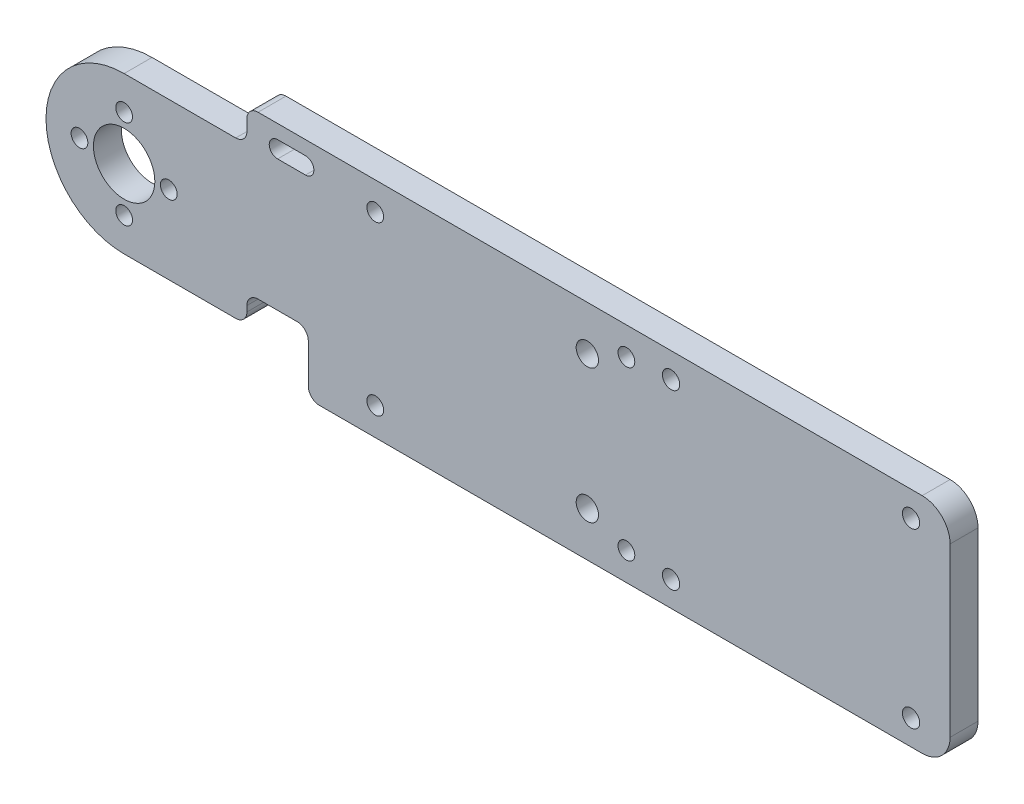
from build123d import *

# Parameters (mm, degrees)
SKETCH2_R           = 5.5
BOSS_EXTRUDE1_DEPTH = 2.5
FILLET1_R           = 5
SKETCH3_R           = 1.55
SKETCH3_R_2         = 2
SKETCH3_R_3         = 1.5
CUT_EXTRUDE1_DEPTH  = 150.428912865
SKETCH3_4_R         = 1.55
SKETCH3_4_R_2       = 2
SKETCH3_4_R_3       = 1.5
CUT_EXTRUDE2_DEPTH  = 10
FILLET2_R           = 2


with BuildPart() as part:
    # Sketch2 → Boss-Extrude1 (new, symmetric)
    with BuildSketch(Plane.XY):
        with BuildLine():
            Line((22, 14), (0, 14))
            ThreePointArc((0, 14), (-14, 0), (0, -14))
            Line((0, -14), (22, -14))
            Line((22, -14), (22, -9))
            Line((22, -9), (33, -9))
            Line((33, -9), (33, -20))
            Line((33, -20), (148, -20))
            Line((148, -20), (148, 20))
            Line((148, 20), (22, 20))
            Line((22, 20), (22, 14))
        make_face()
        Circle(SKETCH2_R, mode=Mode.SUBTRACT)
    extrude(amount=BOSS_EXTRUDE1_DEPTH, both=True)

    # Fillet1
    fillet1_edges = [part.edges().sort_by_distance(p)[0] for p in [
        (148, -20, 0),
        (148, 20, 0),
    ]]
    fillet(fillet1_edges, radius=FILLET1_R)

    # Sketch3 → Cut-Extrude1 (cut, through all)
    with BuildSketch(Plane(origin=(0, 0, -2.5), x_dir=(-1, 0, 0), z_dir=(0, 0, -1))):
        with Locations((-98, 15.5)):
            Circle(SKETCH3_R)
        with Locations((-83, 12)):
            Circle(SKETCH3_R_2)
        with Locations((-8, 0)):
            Circle(SKETCH3_R_3)
        with Locations((8, 0)):
            Circle(SKETCH3_R_3)
        with Locations((0, 8)):
            Circle(SKETCH3_R_3)
        with Locations((0, -8)):
            Circle(SKETCH3_R_3)
        with BuildLine():
            Line((-27.5, 17.5), (-32.5, 17.5))
            ThreePointArc((-32.5, 17.5), (-34, 16), (-32.5, 14.5))
            Line((-32.5, 14.5), (-27.5, 14.5))
            ThreePointArc((-27.5, 14.5), (-26, 16), (-27.5, 17.5))
        make_face()
        with Locations((-98, -15.5)):
            Circle(SKETCH3_R)
        with Locations((-141, -15.5)):
            Circle(SKETCH3_R)
        with Locations((-141, 15.5)):
            Circle(SKETCH3_R)
        with Locations((-90, -15)):
            Circle(SKETCH3_R_3)
        with Locations((-83, -12)):
            Circle(SKETCH3_R_2)
    extrude(amount=-CUT_EXTRUDE1_DEPTH, mode=Mode.SUBTRACT)

    # Sketch3<4> → Cut-Extrude2 (cut)
    with BuildSketch(Plane(origin=(0, 0, -2.5), x_dir=(-1, 0, 0), z_dir=(0, 0, -1))):
        with Locations((-98, 15.5)):
            Circle(SKETCH3_4_R)
        with Locations((-83, 12)):
            Circle(SKETCH3_4_R_2)
        with BuildLine():
            Line((-27.5, 17.5), (-32.5, 17.5))
            ThreePointArc((-32.5, 17.5), (-34, 16), (-32.5, 14.5))
            Line((-32.5, 14.5), (-27.5, 14.5))
            ThreePointArc((-27.5, 14.5), (-26, 16), (-27.5, 17.5))
        make_face()
        with Locations((-98, -15.5)):
            Circle(SKETCH3_4_R)
        with Locations((-141, -15.5)):
            Circle(SKETCH3_4_R)
        with Locations((-141, 15.5)):
            Circle(SKETCH3_4_R)
        with Locations((-90, -15)):
            Circle(SKETCH3_4_R_3)
        with Locations((-45, -15)):
            Circle(SKETCH3_4_R_3)
        with Locations((-90, 15)):
            Circle(SKETCH3_4_R_3)
        with Locations((-83, -12)):
            Circle(SKETCH3_4_R_2)
        with Locations((-45, 15)):
            Circle(SKETCH3_4_R_3)
    extrude(amount=-CUT_EXTRUDE2_DEPTH, mode=Mode.SUBTRACT)

    # Fillet2
    fillet2_edges = [part.edges().sort_by_distance(p)[0] for p in [
        (33, -20, 0),
        (22, 20, 0),
        (22, 14, 0),
        (33, -9, 0),
        (22, -14, 0),
        (22, -9, 0),
    ]]
    fillet(fillet2_edges, radius=FILLET2_R)


solid = part.part
